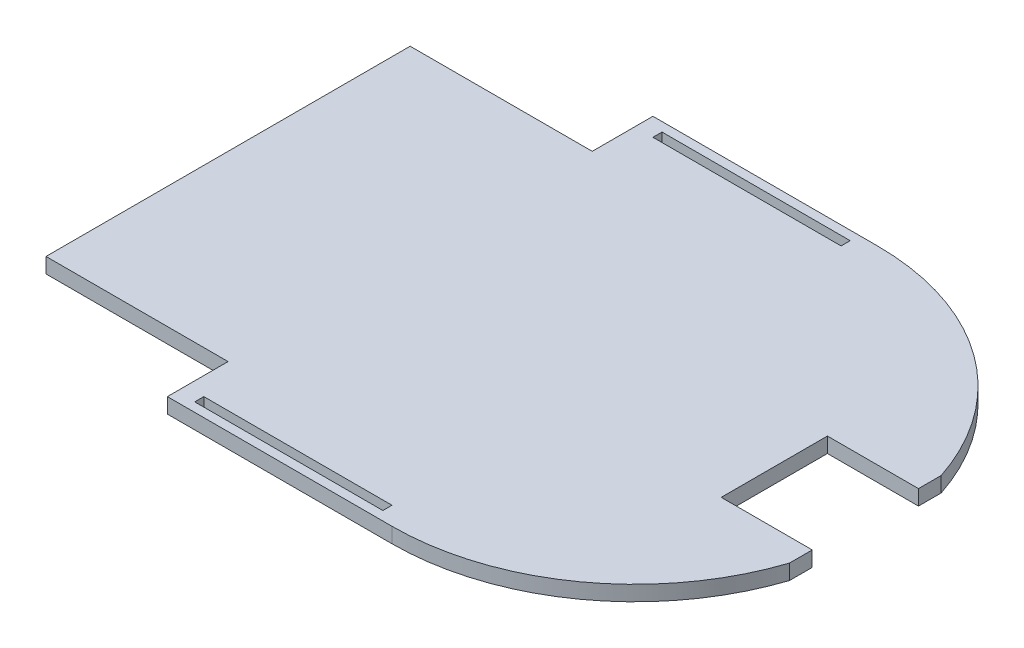
from build123d import *

# Parameters (mm, degrees)
ESTRUSIONE_ESTRUSIONE1_DEPTH  = 5
TAGLIO_ESTRUSIONE1_DEPTH      = 225.77766793
TAGLIO_ESTRUSIONE1_DEPTH_BACK = 225.77766793
SCHIZZO4_W                    = 62.006579232
SCHIZZO4_H                    = 3
TAGLIO_ESTRUSIONE2_DEPTH      = 10


with BuildPart() as part:
    # Schizzo1 → Estrusione-Estrusione1 (new body)
    with BuildSketch(Plane(origin=(0, 0, 0), x_dir=(1, 0, 0), z_dir=(0, 1, 0))):
        with BuildLine():
            Line((60, 60), (60, 80))
            Line((60, 80), (134.006579232, 80))
            ThreePointArc((134.006579232, 80), (180.91073683, 64.807406984), (210, 25))
            Line((210, 25), (210, -25))
            ThreePointArc((210, -25), (180.91073683, -64.807406984), (134.006579232, -80))
            Line((134.006579232, -80), (60, -80))
            Line((60, -80), (60, -60))
            Line((60, -60), (0, -60))
            Line((0, -60), (0, 60))
            Line((0, 60), (60, 60))
        make_face()
    extrude(amount=ESTRUSIONE_ESTRUSIONE1_DEPTH)

    # Schizzo2 → Taglio-Estrusione1 (cut, two sides: drawn at the far end of the back side and taken through both)
    with BuildSketch(Plane(origin=(0, 5, 0), x_dir=(1, 0, 0), z_dir=(0, 1, 0)).offset(-TAGLIO_ESTRUSIONE1_DEPTH_BACK)):
        Polygon((683.060471213, 17.5), (210, 17.5), (180, 17.5), (180, -17.5), (210, -17.5), (683.060471213, -17.5), (1629.181413639, -17.5), (1629.181413639, 17.5), align=None)
    extrude(amount=TAGLIO_ESTRUSIONE1_DEPTH + TAGLIO_ESTRUSIONE1_DEPTH_BACK, mode=Mode.SUBTRACT)

    # Schizzo4 → Taglio-Estrusione2 (cut)
    with BuildSketch(Plane(origin=(0, 5, 0), x_dir=(1, 0, 0), z_dir=(0, 1, 0))):
        with Locations((97.003289616, -75.5)):
            Rectangle(SCHIZZO4_W, SCHIZZO4_H)
        with Locations((97.003289616, 75.5)):
            Rectangle(SCHIZZO4_W, SCHIZZO4_H)
    extrude(amount=-TAGLIO_ESTRUSIONE2_DEPTH, mode=Mode.SUBTRACT)


solid = part.part
